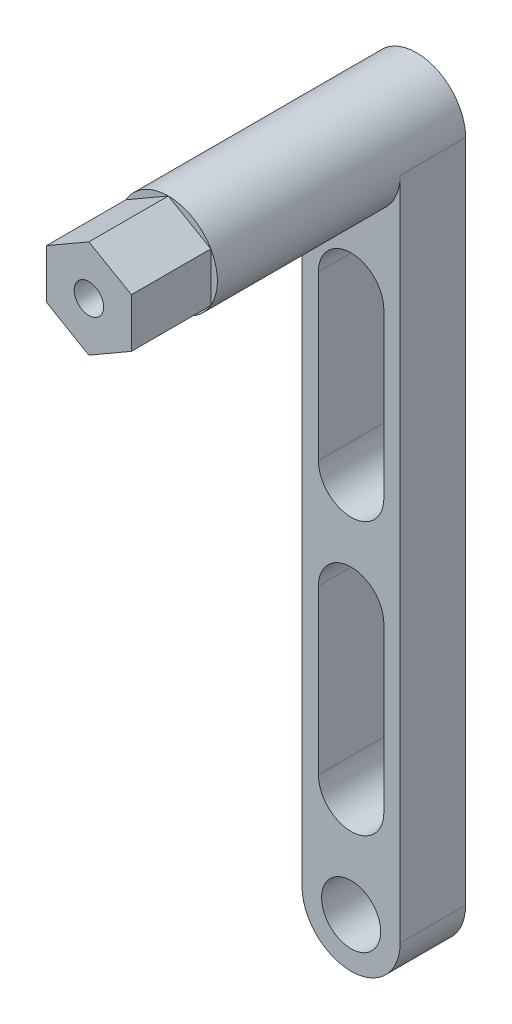
from build123d import *

# Parameters (mm, degrees)
SKETCH1_R           = 4.515
BOSS_EXTRUDE1_DEPTH = 10
BOSS_EXTRUDE2_DEPTH = 37.94
BOSS_EXTRUDE3_DEPTH = 12.14
SKETCH4_R           = 2.25
CUT_EXTRUDE1_DEPTH  = 10


with BuildPart() as part:
    # Sketch1 → Boss-Extrude1 (new body)
    with BuildSketch(Plane.XY):
        with BuildLine():
            Line((-7.5, 50.8), (-7.5, -50.8))
            ThreePointArc((-7.5, -50.8), (0, -58.3), (7.5, -50.8))
            Line((7.5, -50.8), (7.5, 50.8))
            ThreePointArc((7.5, 50.8), (0, 43.3), (-7.5, 50.8))
        make_face()
        with Locations((0, -50.8)):
            Circle(SKETCH1_R, mode=Mode.SUBTRACT)
        with BuildLine():
            ThreePointArc((5, -34.785), (0, -39.785), (-5, -34.785))
            Line((-5, -34.785), (-5, -9.785))
            ThreePointArc((-5, -9.785), (0, -4.785), (5, -9.785))
            Line((5, -9.785), (5, -34.785))
        make_face(mode=Mode.SUBTRACT)
        with BuildLine():
            ThreePointArc((-5, 31.8), (0, 36.8), (5, 31.8))
            Line((5, 31.8), (5, 6.8))
            ThreePointArc((5, 6.8), (0, 1.8), (-5, 6.8))
            Line((-5, 6.8), (-5, 31.8))
        make_face(mode=Mode.SUBTRACT)
    extrude(amount=BOSS_EXTRUDE1_DEPTH)

    # Sketch1<4> → Boss-Extrude2 (add)
    with BuildSketch(Plane.XY):
        with BuildLine():
            ThreePointArc((7.5, 50.8), (0, 58.3), (-7.5, 50.8))
            ThreePointArc((-7.5, 50.8), (0, 43.3), (7.5, 50.8))
        make_face()
    extrude(amount=BOSS_EXTRUDE2_DEPTH)

    # Sketch3 → Boss-Extrude3 (add)
    with BuildSketch(Plane.XY.offset(37.94)):
        Polygon((0, 43.3), (6.495190528, 47.05), (6.495190528, 54.55), (0, 58.3), (-6.495190528, 54.55), (-6.495190528, 47.05), align=None)
    extrude(amount=BOSS_EXTRUDE3_DEPTH)

    # Sketch4 → Cut-Extrude1 (cut)
    with BuildSketch(Plane.XY.offset(50.08)):
        with Locations((0, 50.8)):
            Circle(SKETCH4_R)
    extrude(amount=-CUT_EXTRUDE1_DEPTH, mode=Mode.SUBTRACT)


solid = part.part
